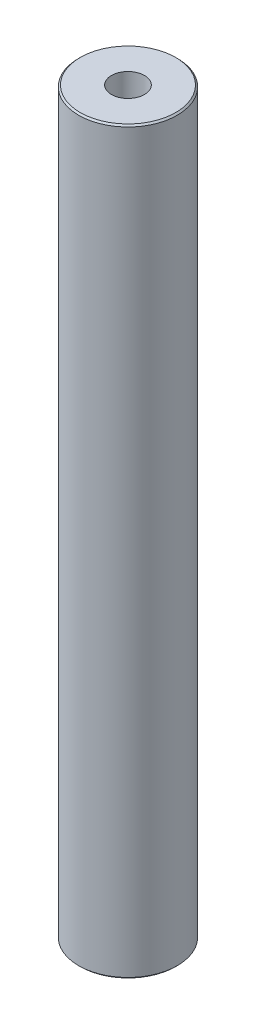
from build123d import *

# Parameters (mm, degrees)
SKETCH1_R           = 40
BOSS_EXTRUDE1_DEPTH = 600
SKETCH2_R           = 13.410092543
CUT_EXTRUDE1_DEPTH  = 603.660766933
CHAMFER1_SIZE       = 1.258505634


with BuildPart() as part:
    # Sketch1 → Boss-Extrude1 (new body)
    with BuildSketch(Plane(origin=(0, 0, 0), x_dir=(1, 0, 0), z_dir=(0, 1, 0))):
        Circle(SKETCH1_R)
    extrude(amount=BOSS_EXTRUDE1_DEPTH)

    # Sketch2 → Cut-Extrude1 (cut, through all)
    with BuildSketch(Plane(origin=(0, 0, 0), x_dir=(1, 0, 0), z_dir=(0, 1, 0))):
        Circle(SKETCH2_R)
    extrude(amount=CUT_EXTRUDE1_DEPTH, mode=Mode.SUBTRACT)

    # Chamfer1
    chamfer1_edges = [part.edges().sort_by_distance(p)[0] for p in [
        (-40, 600, 0),
        (-40, 0, 0),
    ]]
    chamfer(chamfer1_edges, length=CHAMFER1_SIZE)


solid = part.part
